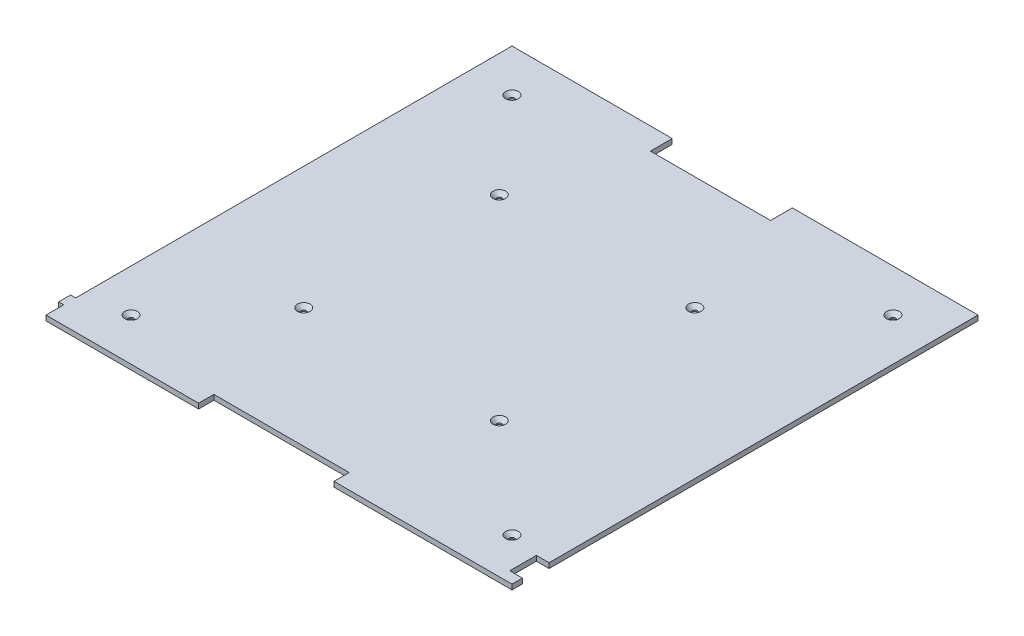
from build123d import *

# Parameters (mm, degrees)
BOSS_EXTRUDE1_DEPTH = 2
SKETCH2_R           = 1
CUT_EXTRUDE1_DEPTH  = 132.191177295
CHAMFER1_SIZE       = 1.5


with BuildPart() as part:
    # Sketch1 → Boss-Extrude1 (new body)
    with BuildSketch(Plane(origin=(0, 0, 0), x_dir=(1, 0, 0), z_dir=(0, 1, 0))):
        Polygon((-91.75, 91.75), (-91.75, -80.05), (-93.75, -80.05), (-93.75, -84.75), (-91.75, -84.75), (-91.75, -91.75), (-31.65, -91.75), (-31.65, -85.75), (21.65, -85.75), (21.65, -91.75), (91.75, -91.75), (91.75, -87.65), (86.75, -87.65), (86.75, -77.15), (91.75, -77.15), (91.75, 91.75), (18.65, 91.75), (18.65, 83.15), (-28.65, 83.15), (-28.65, 91.75), align=None)
    extrude(amount=BOSS_EXTRUDE1_DEPTH)

    # Sketch2 → Cut-Extrude1 (cut, through all)
    with BuildSketch(Plane.XZ):
        with Locations((75, -75)):
            Circle(SKETCH2_R)
        with Locations((-75, -75)):
            Circle(SKETCH2_R)
        with Locations((-75, 75)):
            Circle(SKETCH2_R)
        with Locations((75, 75)):
            Circle(SKETCH2_R)
        with Locations((33.5, -38.5)):
            Circle(SKETCH2_R)
        with Locations((33.5, 38.5)):
            Circle(SKETCH2_R)
        with Locations((-43.5, -38.5)):
            Circle(SKETCH2_R)
        with Locations((-43.5, 38.5)):
            Circle(SKETCH2_R)
    extrude(amount=-CUT_EXTRUDE1_DEPTH, mode=Mode.SUBTRACT)

    # Chamfer1
    chamfer1_edges = [part.edges().sort_by_distance(p)[0] for p in [
        (74, 2, -75),
        (32.5, 2, -38.5),
        (74, 2, 75),
        (32.5, 2, 38.5),
        (-44.5, 2, 38.5),
        (-44.5, 2, -38.5),
        (-76, 2, -75),
        (-76, 2, 75),
    ]]
    chamfer(chamfer1_edges, length=CHAMFER1_SIZE)


solid = part.part
